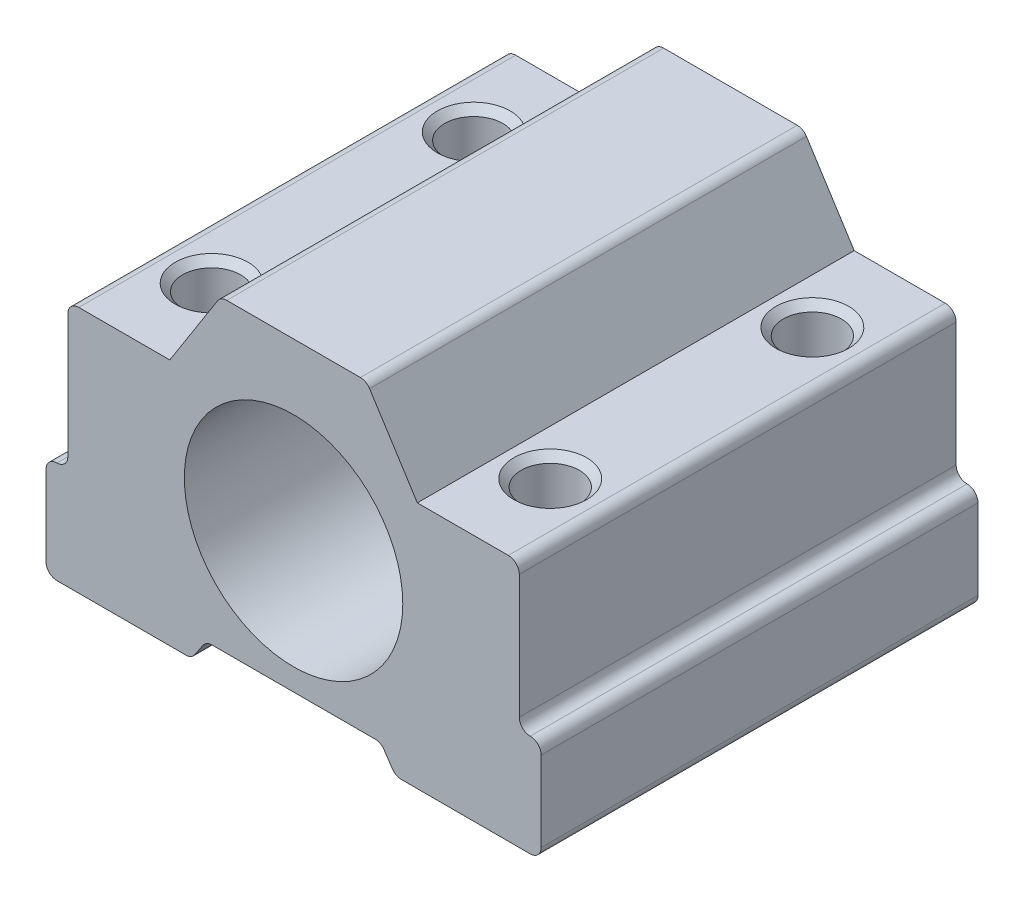
from build123d import *

# Parameters (mm, degrees)
SKETCH_1_R          = 7.5
EXTRUDE_1_DEPTH     = 30
FILLET_1_R          = 0.75
SKETCH_2_R          = 2
CUT_EXTRUDE_1_DEPTH = 39.444765573
CHAMFER_1_SIZE      = 0.5


with BuildPart() as part:
    # 草图1 → 凸台-拉伸1 (new body)
    with BuildSketch(Plane.XY):
        Polygon((5, 11.25), (-5, 11.25), (-8.5, 5.75), (-15.5, 5.75), (-15.5, -4.25), (-17, -4.25), (-17, -11.25), (-7, -11.25), (-6, -9.75), (6, -9.75), (7, -11.25), (17, -11.25), (17, -4.25), (15.5, -4.25), (15.5, 5.75), (8.5, 5.75), align=None)
        with Locations((0, -0.75)):
            Circle(SKETCH_1_R, mode=Mode.SUBTRACT)
    extrude(amount=EXTRUDE_1_DEPTH)

    # 圆角1
    fillet_1_edges = [part.edges().sort_by_distance(p)[0] for p in [
        (-17, -11.25, 15),
        (-7, -11.25, 15),
        (-6, -9.75, 15),
        (7, -11.25, 15),
        (6, -9.75, 15),
        (17, -11.25, 15),
        (17, -4.25, 15),
        (15.5, -4.25, 15),
        (15.5, 5.75, 15),
        (5, 11.25, 15),
        (-5, 11.25, 15),
        (-17, -4.25, 15),
        (-15.5, -4.25, 15),
        (-15.5, 5.75, 15),
    ]]
    fillet(fillet_1_edges, radius=FILLET_1_R - 0.0001)  # a hair under: the kernel refuses the full size

    # 草图2 → 切除-拉伸1 (cut, through all)
    with BuildSketch(Plane(origin=(0, 5.75, 0), x_dir=(1, 0, 0), z_dir=(0, 1, 0))):
        with Locations(Location((-11.625, -6, 0), (0, 0, 180))):
            Circle(SKETCH_2_R)
        with Locations(Location((-11.625, -24, 0), (0, 0, 180))):
            Circle(SKETCH_2_R)
        with Locations((11.625, -24)):
            Circle(SKETCH_2_R)
        with Locations((11.625, -6)):
            Circle(SKETCH_2_R)
    extrude(amount=-CUT_EXTRUDE_1_DEPTH, mode=Mode.SUBTRACT)

    # 倒角1
    chamfer_1_edges = [part.edges().sort_by_distance(p)[0] for p in [
        (-9.625, -11.25, 24),
        (-9.625, 5.75, 24),
        (9.625, -11.25, 6),
        (9.625, 5.75, 6),
        (-9.625, -11.25, 6),
        (-9.625, 5.75, 6),
        (9.625, -11.25, 24),
        (9.625, 5.75, 24),
    ]]
    chamfer(chamfer_1_edges, length=CHAMFER_1_SIZE)


solid = part.part
